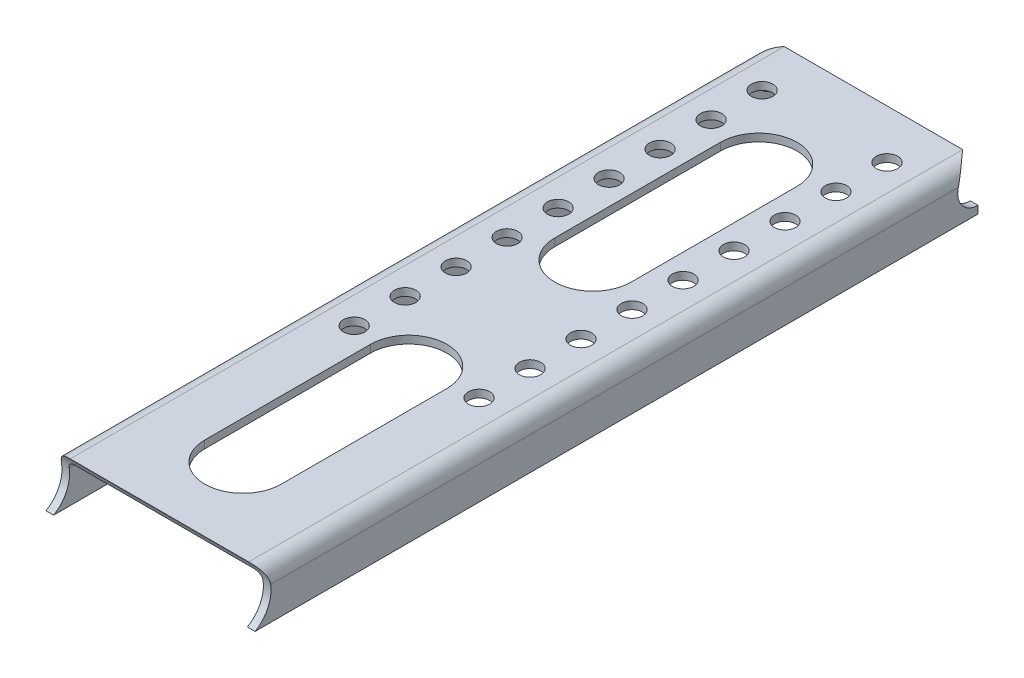
from build123d import *

# Parameters (mm, degrees)
SKETCH1_W                   = 70
SKETCH1_H                   = 290
BASE_FLANGE1_DEPTH          = 3
SM_EDGE_FLANGE_1_DEPTH      = 290
SM_EDGE_FLANGE_1_BEND_DEPTH = 290
INDENT1_START               = -127
INDENT1_DEPTH               = 84
INDENT1_START_2             = -123.729611107
INDENT1_2_DEPTH             = 77.459222009
INDENT1_3_DEPTH             = 0.729611107
INDENT1_START_3             = -47
INDENT1_4_DEPTH             = 0.729610902
INDENT1_START_4             = -50.0000001
INDENT1_5_DEPTH             = 6.0000001
INDENT1_START_5             = -126
INDENT1_6_DEPTH             = 6
INDENT1_START_6             = -290
INDENT1_7_DEPTH             = 6.65
INDENT2_START               = -127
INDENT2_DEPTH               = 84
INDENT2_START_2             = -11.0000001
INDENT2_2_DEPTH             = 11.0000001
INDENT2_START_3             = -126
INDENT2_3_DEPTH             = 82
CUT_EXTRUDE1_DEPTH          = 317.754179273
CUT_EXTRUDE1_DEPTH_BACK     = 317.754179273
SKETCH12_R                  = 4.2
CUT_EXTRUDE2_DEPTH          = 10


with BuildPart() as part:
    # Base-Flange1: sheet metal written as solids
    # Sketch1 → Base-Flange1 (new body)
    with BuildSketch(Plane(origin=(0, 207.95, 0), x_dir=(1, 0, 0), z_dir=(0, 1, 0))):
        with Locations((-85, 145)):
            Rectangle(SKETCH1_W, SKETCH1_H)
    extrude(amount=-BASE_FLANGE1_DEPTH)

    # 邊線-凸緣1: sheet metal written as solids
    # 邊線-凸緣1 section (on a plane across the edge) → 邊線-凸緣1 (add)
    with BuildSketch(Plane(origin=(-47, 204.95, -290), x_dir=(-1, 0, 0), z_dir=(0, 0, 1))):
        with BuildLine():
            Line((-3, 3), (-3, 15.9))
            Line((-3, 15.9), (0, 15.9))
            Line((0, 15.9), (0, 3))
            ThreePointArc((0, 3), (0.878679656, 0.878679656), (3, 0))
            Line((3, 0), (3, -3))
            ThreePointArc((3, -3), (-1.242640687, -1.242640687), (-3, 3))
        make_face()
    extrude(amount=SM_EDGE_FLANGE_1_DEPTH)

    # 邊線-凸緣1 section 2 (on a plane across the edge) → 邊線-凸緣1 bend (add)
    with BuildSketch(Plane(origin=(-123, 204.95, 0), x_dir=(1, 0, 0), z_dir=(0, 0, -1))):
        with BuildLine():
            Line((-3, 3), (-3, 15.9))
            Line((-3, 15.9), (0, 15.9))
            Line((0, 15.9), (0, 3))
            ThreePointArc((0, 3), (0.878679656, 0.878679656), (3, 0))
            Line((3, 0), (3, -3))
            ThreePointArc((3, -3), (-1.242640687, -1.242640687), (-3, 3))
        make_face()
    extrude(amount=SM_EDGE_FLANGE_1_BEND_DEPTH)

    # Indent1: read off the stored shape, not the designer's step
    # Indent1 outline → Indent1 (cut)
    with BuildSketch(Plane.YZ.offset(INDENT1_START)):
        with BuildLine():
            Line((192.05, -290), (207.95, -290))
            ThreePointArc((207.95, -290), (200, -282.05), (192.05, -290))
        make_face()
    extrude(amount=INDENT1_DEPTH, mode=Mode.SUBTRACT)

    # Indent2: read off the stored shape, not the designer's step
    # Indent2 outline → Indent2 (cut)
    with BuildSketch(Plane.YZ.offset(INDENT2_START)):
        with BuildLine():
            ThreePointArc((189.05, -6.433311744), (197.7062633, -12.491147744), (207.950014124, -9.903902031))
            Line((207.950014124, -9.903902031), (209, -9.061062257))
            Line((209, -9.061062257), (209, 1))
            Line((209, 1), (188, 1))
            Line((188, 1), (188, 0))
            Line((188, 0), (188, -4.64612958))
            Line((188, -4.64612958), (189.05, -6.433311744))
        make_face()
    extrude(amount=INDENT2_DEPTH, mode=Mode.SUBTRACT)

    # Sketch12 → Cut-Extrude1 (cut, two sides: drawn at the far end of the back side and taken through both)
    with BuildSketch(Plane(origin=(0, 207.95, 0), x_dir=(1, 0, 0), z_dir=(0, 1, 0)).offset(-CUT_EXTRUDE1_DEPTH_BACK)):
        with Locations((-109.5, 270.8)):
            Circle(SKETCH12_R)
        with Locations((-60.5, 270.8)):
            Circle(SKETCH12_R)
        with Locations((-60.5, 250.8)):
            Circle(SKETCH12_R)
        with Locations((-109.5, 250.8)):
            Circle(SKETCH12_R)
        with Locations((-60.5, 230.8)):
            Circle(SKETCH12_R)
        with Locations((-109.5, 230.8)):
            Circle(SKETCH12_R)
        with Locations((-60.5, 210.8)):
            Circle(SKETCH12_R)
        with Locations((-109.5, 210.8)):
            Circle(SKETCH12_R)
        with Locations((-60.5, 190.8)):
            Circle(SKETCH12_R)
        with Locations((-109.5, 190.8)):
            Circle(SKETCH12_R)
        with Locations((-60.5, 170.8)):
            Circle(SKETCH12_R)
        with Locations((-109.5, 170.8)):
            Circle(SKETCH12_R)
        with Locations((-60.5, 150.8)):
            Circle(SKETCH12_R)
        with Locations((-109.5, 150.8)):
            Circle(SKETCH12_R)
        with Locations((-60.5, 130.8)):
            Circle(SKETCH12_R)
        with Locations((-109.5, 130.8)):
            Circle(SKETCH12_R)
        with Locations((-60.5, 110.8)):
            Circle(SKETCH12_R)
        with Locations((-109.5, 110.8)):
            Circle(SKETCH12_R)
    extrude(amount=CUT_EXTRUDE1_DEPTH + CUT_EXTRUDE1_DEPTH_BACK, mode=Mode.SUBTRACT)

    # Sketch13 → Cut-Extrude2 (cut)
    with BuildSketch(Plane(origin=(0, 207.95, 0), x_dir=(1, 0, 0), z_dir=(0, 1, 0))):
        with BuildLine():
            Line((-70, 107.7), (-70, 42.7))
            ThreePointArc((-70, 42.7), (-85, 27.7), (-100, 42.7))
            Line((-100, 42.7), (-100, 107.7))
            ThreePointArc((-100, 107.7), (-85, 122.7), (-70, 107.7))
        make_face()
        with BuildLine():
            Line((-70, 245), (-70, 180))
            ThreePointArc((-70, 180), (-85, 165), (-100, 180))
            Line((-100, 180), (-100, 245))
            ThreePointArc((-100, 245), (-85, 260), (-70, 245))
        make_face()
    extrude(amount=-CUT_EXTRUDE2_DEPTH, mode=Mode.SUBTRACT)


with BuildPart() as body_2:
    # Indent1 2 outline → Indent1 2 (new body)
    with BuildSketch(Plane.YZ.offset(INDENT1_START_2)):
        with BuildLine():
            Line((204.95, -285.559279338), (204.95, -290))
            Line((204.95, -290), (206.65, -290))
            ThreePointArc((206.65, -290), (206.210475022, -287.622501314), (204.95, -285.559279338))
        make_face()
    extrude(amount=INDENT1_2_DEPTH)

    # Indent1 3 outline → Indent1 3 (add)
    with BuildSketch(Plane.YZ.offset(INDENT1_START_2)):
        with BuildLine():
            Line((193.35, -290), (204.95, -290))
            Line((204.95, -290), (204.95, -285.559279338))
            ThreePointArc((204.95, -285.559279338), (197.622501314, -283.789524978), (193.35, -290))
        make_face()
    extrude(amount=INDENT1_3_DEPTH)

    # Indent1 4 outline → Indent1 4 (add)
    with BuildSketch(Plane.YZ.offset(INDENT1_START_3)):
        with BuildLine():
            Line((193.35, -290), (204.95, -290))
            Line((204.95, -290), (204.95, -285.559279338))
            ThreePointArc((204.95, -285.559279338), (197.622501314, -283.789524978), (193.35, -290))
        make_face()
    extrude(amount=INDENT1_4_DEPTH)

    # Indent1 5 outline → Indent1 5 (add)
    with BuildSketch(Plane.YZ.offset(INDENT1_START_4)):
        with BuildLine():
            Line((193.35, -290), (206.65, -290))
            ThreePointArc((206.65, -290), (200, -283.35), (193.35, -290))
        make_face()
    extrude(amount=INDENT1_5_DEPTH)

    # Indent1 6 outline → Indent1 6 (add)
    with BuildSketch(Plane.YZ.offset(INDENT1_START_5)):
        with BuildLine():
            Line((193.35, -290), (206.65, -290))
            ThreePointArc((206.65, -290), (200, -283.35), (193.35, -290))
        make_face()
    extrude(amount=INDENT1_6_DEPTH)

    # Indent1 7 outline → Indent1 7 (cut)
    with BuildSketch(Plane.XY.offset(INDENT1_START_6)):
        with BuildLine():
            Line((-47, 192), (-47, 201.95))
            ThreePointArc((-47, 201.95), (-47.878679656, 204.071320344), (-50, 204.95))
            Line((-50, 204.95), (-50.0000001, 192))
            Line((-50.0000001, 192), (-47, 192))
        make_face()
        with BuildLine():
            Line((-123, 192), (-120, 192))
            Line((-120, 192), (-120, 204.95))
            ThreePointArc((-120, 204.95), (-122.121320344, 204.071320344), (-123, 201.95))
            Line((-123, 201.95), (-123, 192))
        make_face()
        with BuildLine():
            ThreePointArc((-46.270396534, 206.650006169), (-44.597333029, 204.559825589), (-44, 201.95))
            Line((-44, 201.95), (-44, 208))
            Line((-44, 208), (-47.971644239, 208))
            Line((-47.971644239, 208), (-46.270396534, 206.650006169))
        make_face()
        with BuildLine():
            Line((-126, 208), (-126, 201.95))
            ThreePointArc((-126, 201.95), (-125.402668364, 204.559822705), (-123.729608483, 206.650002187))
            Line((-123.729608483, 206.650002187), (-122.028359489, 208))
            Line((-122.028359489, 208), (-126, 208))
        make_face()
    extrude(amount=INDENT1_7_DEPTH, mode=Mode.SUBTRACT)


with BuildPart() as body_3:
    # Indent2 2 outline → Indent2 2 (new body)
    with BuildSketch(Plane.XY.offset(INDENT2_START_2)):
        with BuildLine():
            Line((-44, 189.05), (-44, 201.95))
            ThreePointArc((-44, 201.95), (-45.757359313, 206.192640687), (-50, 207.95))
            Line((-50, 207.95), (-120, 207.95))
            ThreePointArc((-120, 207.95), (-124.242640687, 206.192640687), (-126, 201.95))
            Line((-126, 201.95), (-126, 189.05))
            Line((-126, 189.05), (-123, 189.05))
            Line((-123, 189.05), (-123, 201.95))
            ThreePointArc((-123, 201.95), (-122.121320344, 204.071320344), (-120, 204.95))
            Line((-120, 204.95), (-50, 204.95))
            ThreePointArc((-50, 204.95), (-47.878679656, 204.071320344), (-47, 201.95))
            Line((-47, 201.95), (-47, 189.05))
            Line((-47, 189.05), (-44, 189.05))
        make_face()
    extrude(amount=INDENT2_2_DEPTH)

    # Indent2 3 outline → Indent2 3 (cut)
    with BuildSketch(Plane.YZ.offset(INDENT2_START_3)):
        with BuildLine():
            Line((207.95, -11.0000001), (207.950016725, -7.602449216))
            ThreePointArc((207.950016725, -7.602449216), (204.322791843, -10.115012145), (200.000000001, -11))
            Line((200.000000001, -11), (207.95, -11.0000001))
        make_face()
        with BuildLine():
            Line((189.05, -11.0000001), (200.000000001, -11))
            ThreePointArc((200.000000001, -11), (192.601479194, -8.140140655), (189.05, -1.047616342))
            Line((189.05, -1.047616342), (189.05, -11.0000001))
        make_face()
    extrude(amount=INDENT2_3_DEPTH, mode=Mode.SUBTRACT)


solid = part.part
